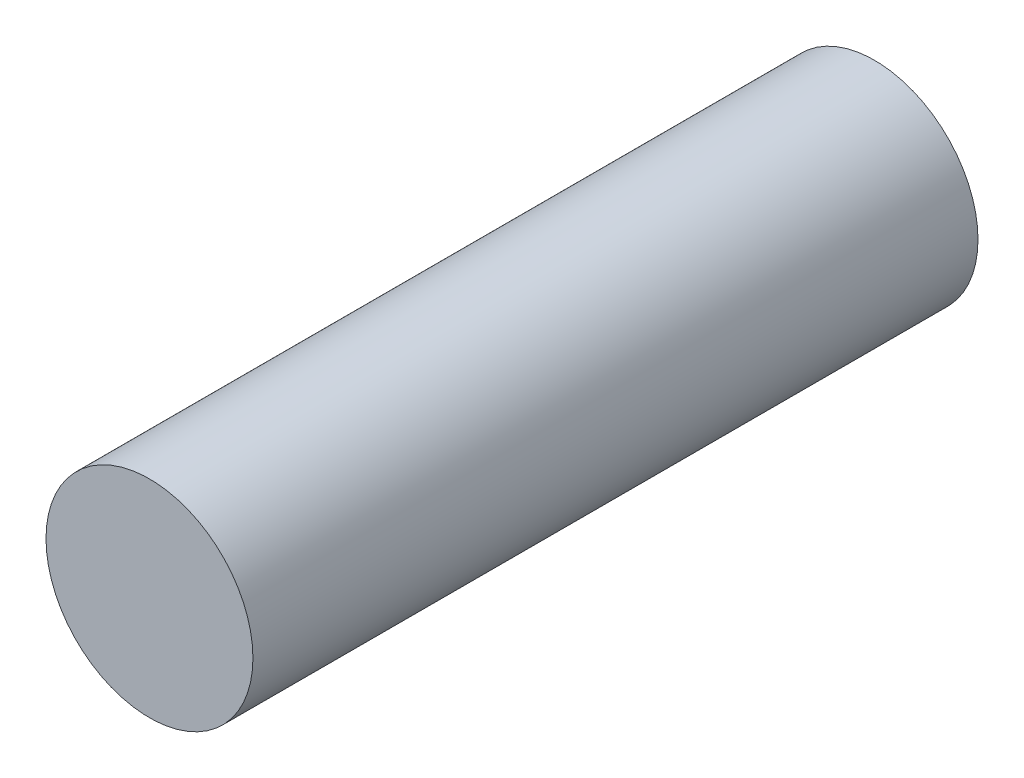
from build123d import *

# Parameters (mm, degrees)
SKETCH1_R           = 6.35
BOSS_EXTRUDE1_DEPTH = 44.5


with BuildPart() as part:
    # Sketch1 → Boss-Extrude1 (new body)
    with BuildSketch(Plane.XY):
        Circle(SKETCH1_R)
    extrude(amount=BOSS_EXTRUDE1_DEPTH)


solid = part.part
